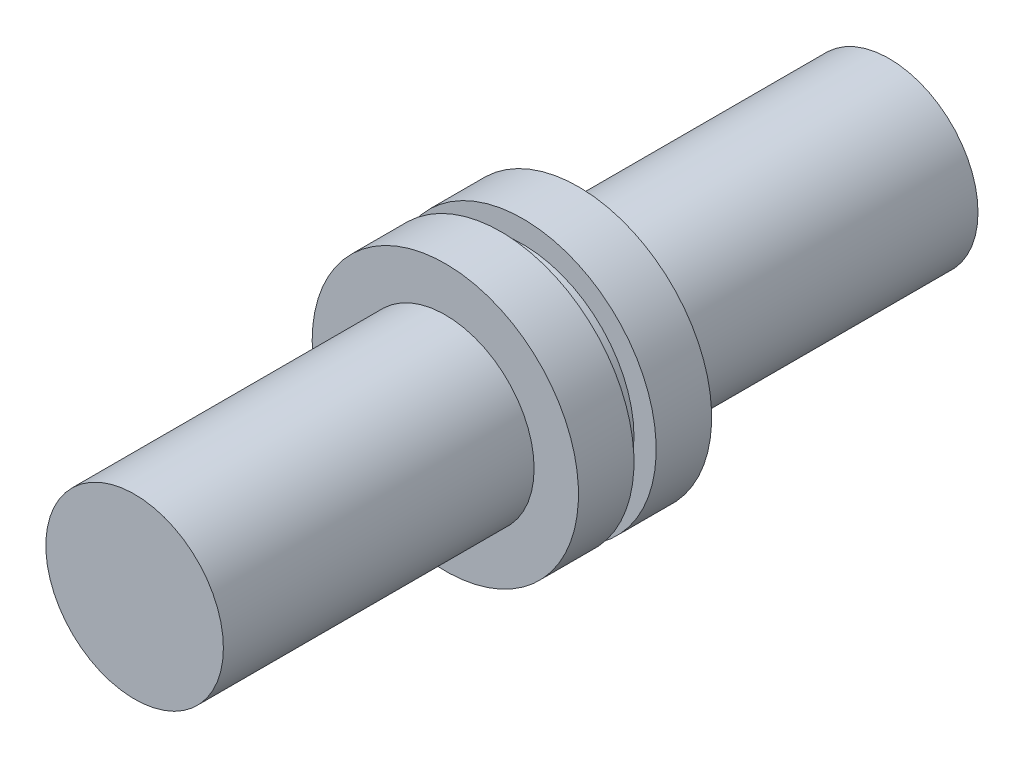
from build123d import *

# Parameters (mm, degrees)
SKETCH1_R           = 2
BOSS_EXTRUDE1_DEPTH = 17
F_3DSKETCH2_R       = 3
BOSS_EXTRUDE2_DEPTH = 3
F_3DSKETCH3_R       = 3.429015923
F_3DSKETCH3_R_2     = 2.5
CUT_EXTRUDE1_DEPTH  = 0.5


with BuildPart() as part:
    # Sketch1 → Boss-Extrude1 (new body)
    with BuildSketch(Plane.XY):
        Circle(SKETCH1_R)
    extrude(amount=BOSS_EXTRUDE1_DEPTH)

    # 3DSketch2 → Boss-Extrude2 (add)
    with BuildSketch(Plane.XY.offset(7)):
        Circle(F_3DSKETCH2_R)
    extrude(amount=BOSS_EXTRUDE2_DEPTH)

    # 3DSketch3 → Cut-Extrude1 (cut)
    with BuildSketch(Plane.XY.offset(8.75)):
        Circle(F_3DSKETCH3_R)
        Circle(F_3DSKETCH3_R_2, mode=Mode.SUBTRACT)
    extrude(amount=-CUT_EXTRUDE1_DEPTH, mode=Mode.SUBTRACT)


solid = part.part
